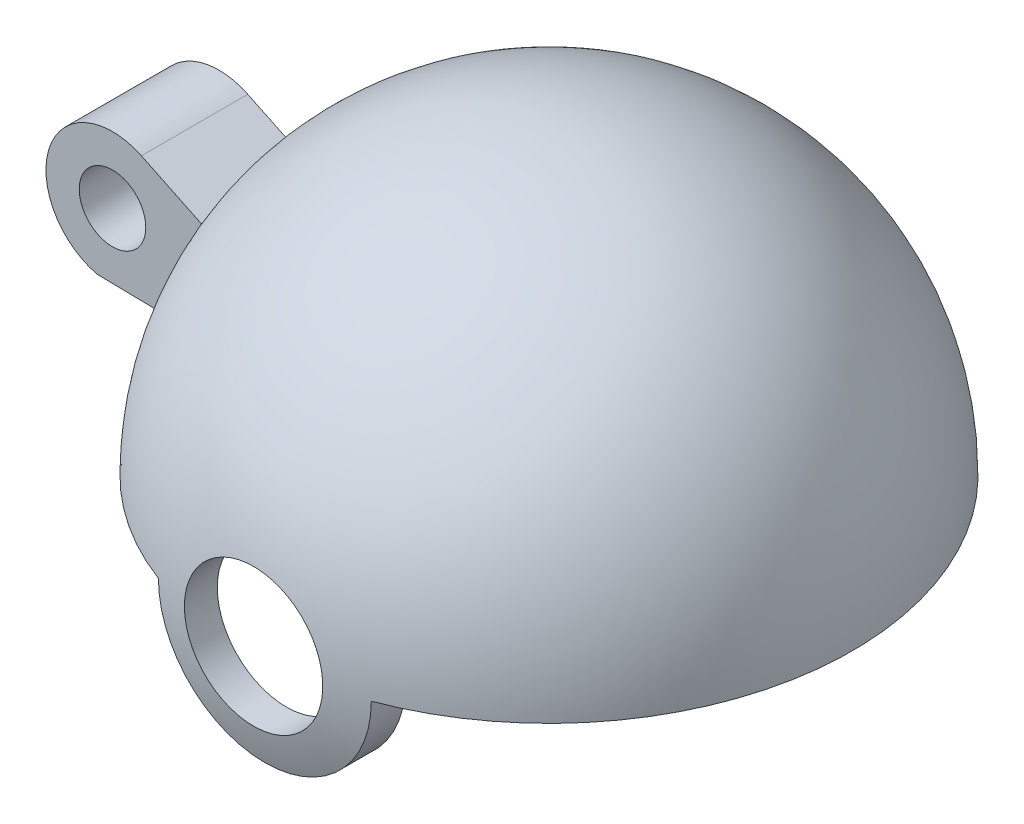
from build123d import *

# Parameters (mm, degrees)
BOSS_EXTRUDE2_START     = 2.54
SKETCH5_R               = 1.5875
BOSS_EXTRUDE2_DEPTH     = 5.08
CUT_EXTRUDE2_DEPTH      = 30.662861241
CUT_EXTRUDE2_DEPTH_BACK = 30.662861241
SKETCH7_R               = 3.302
CUT_EXTRUDE3_DEPTH      = 30.478502944
CUT_EXTRUDE3_DEPTH_BACK = 30.478502944


with BuildPart() as part:
    # Sketch1 → Revolve1 (revolve)
    with BuildSketch(Plane.XY):
        with BuildLine():
            Line((0, 12.954), (0, 14.478))
            ThreePointArc((0, 14.478), (-14.478, 0), (0, -14.478))
            Line((0, -14.478), (0, -12.954))
            ThreePointArc((0, -12.954), (-12.954, 0), (0, 12.954))
        make_face()
    revolve(axis=Axis((0, 0, 0), (0, 1, 0)))

    # Sketch5 → Boss-Extrude2 (add)
    with BuildSketch(Plane.XY.offset(BOSS_EXTRUDE2_START)):
        with BuildLine():
            Line((-13.509869394, 4.51765424), (-13.755118472, 4.51765424))
            Line((-13.755118472, 4.51765424), (-16.91158996, 6.036139703))
            ThreePointArc((-16.91158996, 6.036139703), (-21.279157214, 4.239708186), (-19.028959124, 0.087670316))
            Line((-19.028959124, 0.087670316), (-14.478, 0))
            Line((-14.478, 0), (-14.232750922, 0))
            Line((-14.232750922, 0), (-13.509869394, 4.51765424))
        make_face()
        with Locations((-18.288, 3.175)):
            Circle(SKETCH5_R, mode=Mode.SUBTRACT)
    extrude(amount=-BOSS_EXTRUDE2_DEPTH)

    # Sketch7 → Cut-Extrude2 (cut, two sides: drawn at the far end of the back side and taken through both)
    with BuildSketch(Plane.XY.offset(-CUT_EXTRUDE2_DEPTH_BACK)):
        Circle(SKETCH7_R)
    extrude(amount=CUT_EXTRUDE2_DEPTH + CUT_EXTRUDE2_DEPTH_BACK, mode=Mode.SUBTRACT)

    # Sketch8 → Cut-Extrude3 (cut, two sides: drawn at the far end of the back side and taken through both)
    with BuildSketch(Plane.XY.offset(-CUT_EXTRUDE3_DEPTH_BACK)):
        with BuildLine():
            Line((-101.972979579, 0), (-14.478, 0))
            Line((-14.478, 0), (-5.08, 0))
            ThreePointArc((-5.08, 0), (0, -5.08), (5.08, 0))
            Line((5.08, 0), (14.478, 0))
            Line((14.478, 0), (101.972979579, 0))
            Line((101.972979579, 0), (101.972979579, -174.989959159))
            Line((101.972979579, -174.989959159), (-101.972979579, -174.989959159))
            Line((-101.972979579, -174.989959159), (-101.972979579, 0))
        make_face()
    extrude(amount=CUT_EXTRUDE3_DEPTH + CUT_EXTRUDE3_DEPTH_BACK, mode=Mode.SUBTRACT)


solid = part.part
